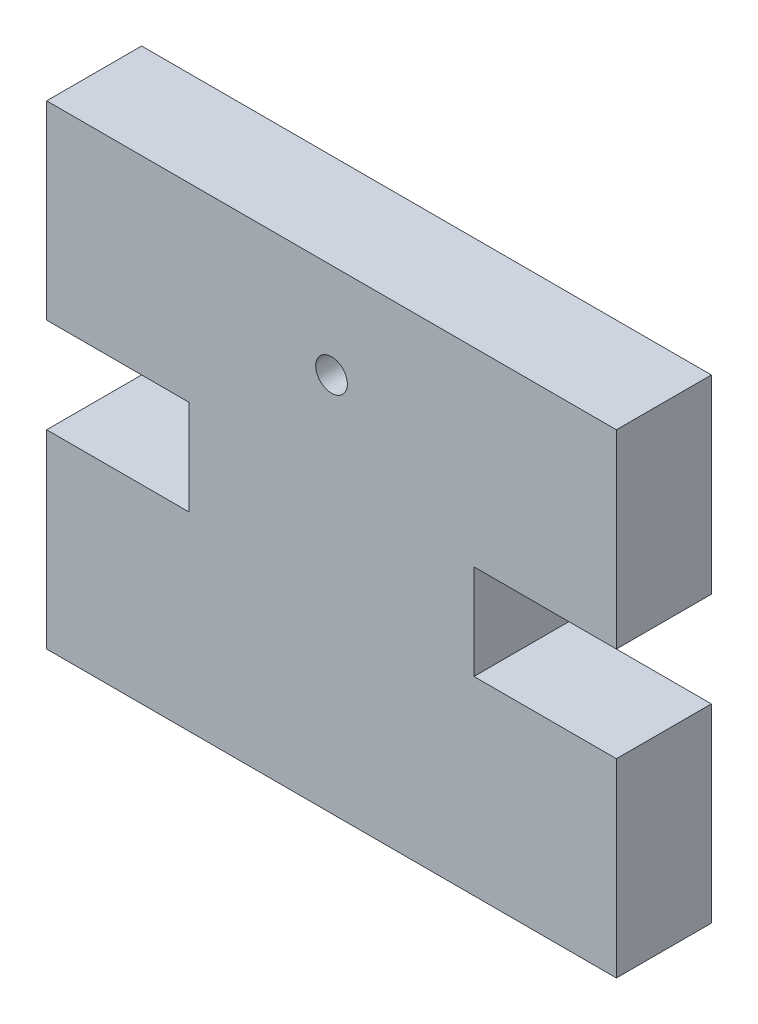
from build123d import *

# Parameters (mm, degrees)
SKETCH1_R           = 0.5
BOSS_EXTRUDE1_DEPTH = 3


with BuildPart() as part:
    # Sketch1 → Boss-Extrude1 (new body)
    with BuildSketch(Plane.XY):
        Polygon((0, 0), (-4.5, 0), (-4.5, -6), (13.5, -6), (13.5, 0), (9, 0), (9, 3), (13.5, 3), (13.5, 9), (-4.5, 9), (-4.5, 3), (0, 3), align=None)
        with Locations((4.5, 6)):
            Circle(SKETCH1_R, mode=Mode.SUBTRACT)
    extrude(amount=BOSS_EXTRUDE1_DEPTH)


solid = part.part
